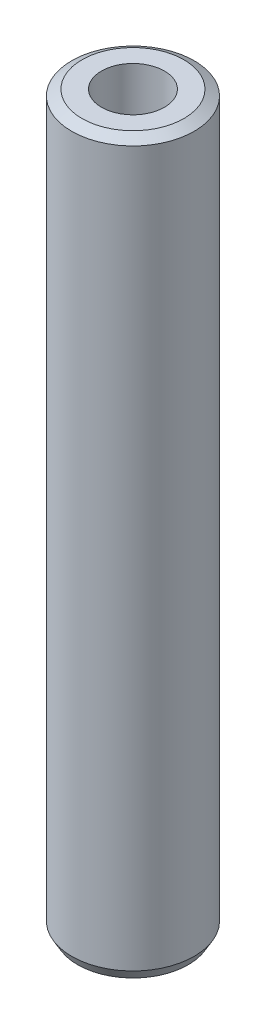
from build123d import *
from OCP.BRepFilletAPI import BRepFilletAPI_MakeChamfer

# Parameters (mm, degrees)
SKETCH1_R           = 12.5
BOSS_EXTRUDE1_DEPTH = 149.163204077
SKETCH2_R           = 6.424283762
CUT_EXTRUDE1_DEPTH  = 151.20706192
CHAMFER1_SIZE       = 1.211501282
CHAMFER1_SIZE2      = 2.098381774


with BuildPart() as part:
    # Sketch1 → Boss-Extrude1 (new body)
    with BuildSketch(Plane(origin=(0, 0, 0), x_dir=(1, 0, 0), z_dir=(0, 1, 0))):
        Circle(SKETCH1_R)
    extrude(amount=BOSS_EXTRUDE1_DEPTH)

    # Sketch2 → Cut-Extrude1 (cut, through all)
    with BuildSketch(Plane(origin=(0, 0, 0), x_dir=(1, 0, 0), z_dir=(0, 1, 0))):
        Circle(SKETCH2_R)
    extrude(amount=CUT_EXTRUDE1_DEPTH, mode=Mode.SUBTRACT)

    # Chamfer1: one chamfer whose edges measure the first distance from different faces: ONE call of the kernel's chamfer builder (chamfer() names one face for all edges)
    chamfer1_edges_1 = [part.edges().sort_by_distance(p)[0] for p in [
        (-12.5, 149.163204077, 0),
    ]]
    chamfer1_side_1 = [part.faces().sort_by_distance(p)[0] for p in [
        (-12.5, 74.581602039, 0),
    ]]
    chamfer1_edges_2 = [part.edges().sort_by_distance(p)[0] for p in [
        (-12.5, 0, 0),
    ]]
    chamfer1_side_2 = [part.faces().sort_by_distance(p)[0] for p in [
        (-12.146446609, 0, 0),
    ]]
    chamfer1 = BRepFilletAPI_MakeChamfer(part.part.solid().wrapped)
    for e in chamfer1_edges_1:
        chamfer1.Add(CHAMFER1_SIZE, CHAMFER1_SIZE2, e.wrapped, chamfer1_side_1[0].wrapped)  # the first distance lies on this face
    for e in chamfer1_edges_2:
        chamfer1.Add(CHAMFER1_SIZE, CHAMFER1_SIZE2, e.wrapped, chamfer1_side_2[0].wrapped)  # the first distance lies on this face
    add(Compound.cast(chamfer1.Shape()), mode=Mode.REPLACE)


solid = part.part
